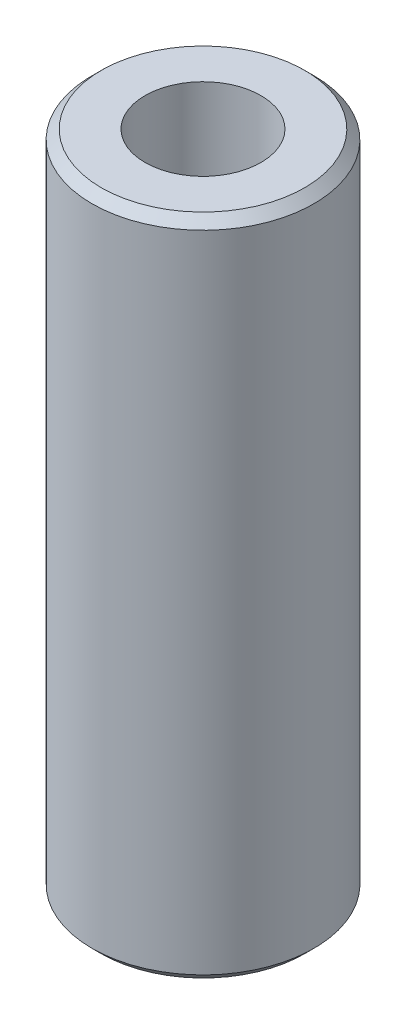
from build123d import *

# Parameters (mm, degrees)
CROQUIS2_R                = 4.7625
SALIENTE_EXTRUIR1_DEPTH   = 14.2367
CHAFL_N1_SIZE             = 0.396875
CLEARANCE_HOLE_DEPTH      = 16.749490131
CLEARANCE_HOLE_DEPTH_BACK = 16.749490131
CROQUIS4_R                = 2.4892


with BuildPart() as part:
    # Croquis2 → Saliente-Extruir1 (new, symmetric)
    with BuildSketch(Plane(origin=(0, 0, 0), x_dir=(1, 0, 0), z_dir=(0, 1, 0))):
        Circle(CROQUIS2_R)
    extrude(amount=SALIENTE_EXTRUIR1_DEPTH, both=True)

    # Chaflán1
    chafl_n1_edges = [part.edges().sort_by_distance(p)[0] for p in [
        (-4.7625, -14.2367, 0),
        (-4.7625, 14.2367, 0),
    ]]
    chamfer(chafl_n1_edges, length=CHAFL_N1_SIZE)

    # Croquis4 → Clearance Hole (cut, two sides: drawn at the far end of the back side and taken through both)
    with BuildSketch(Plane(origin=(0, 0, 0), x_dir=(1, 0, 0), z_dir=(0, 1, 0)).offset(-CLEARANCE_HOLE_DEPTH_BACK)):
        Circle(CROQUIS4_R)
    extrude(amount=CLEARANCE_HOLE_DEPTH + CLEARANCE_HOLE_DEPTH_BACK, mode=Mode.SUBTRACT)


solid = part.part
